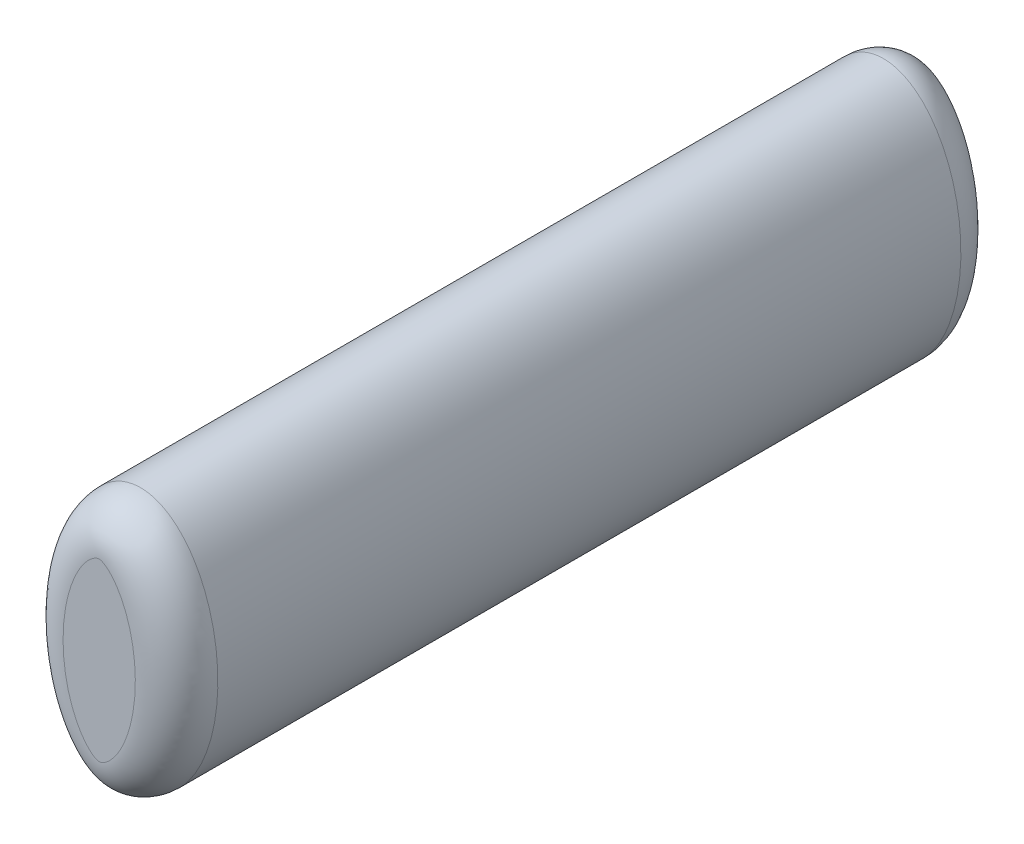
from build123d import *

# Parameters (mm, degrees)
AUFSATZ_LINEAR_AUSTRAGEN2_DEPTH = 80
SKIZZE4_W                       = 40
SKIZZE4_H                       = 5
SCHNITT_LINEAR_AUSTRAGEN1_DEPTH = 1.5
VERRUNDUNG2_R                   = 4


with BuildPart() as part:
    # Skizze1 → Aufsatz-Linear austragen2 (new body)
    with BuildSketch(Plane.XY):
        with BuildLine():
            Line((0, 12.5), (0, 0))
            Line((0, 0), (-7.5, 0))
            add(Edge.make_bspline(
                [(0, 12.5), (-7.5, 12.5), (-7.5, 0)],
                knots=[0, 0, 0, 1.570796327, 1.570796327, 1.570796327], degree=2, weights=[1, 0.707106781, 1]))
        make_face()
    extrude(amount=AUFSATZ_LINEAR_AUSTRAGEN2_DEPTH)

    # Skizze4 → Schnitt-Linear austragen1 (cut)
    with BuildSketch(Plane(origin=(0, 0, 0), x_dir=(0, 0, -1), z_dir=(1, 0, 0))):
        with Locations((-20, 2.5)):
            Rectangle(SKIZZE4_W, SKIZZE4_H)
    extrude(amount=-SCHNITT_LINEAR_AUSTRAGEN1_DEPTH, mode=Mode.SUBTRACT)

    # Verrundung2
    verrundung2_edges = [part.edges().sort_by_distance(p)[0] for p in [
        (-5.885487055, 7.747946344, 0),
        (-5.885487055, 7.747946344, 80),
    ]]
    fillet(verrundung2_edges, radius=VERRUNDUNG2_R)

    # Spiegeln1: part across plane


with BuildPart() as part_1:
    add(part.part)
    add(part.part.mirror(Plane(origin=(0, 0, 80), x_dir=(0, 0, 1), z_dir=(0, 1, 0))))

    # Spiegeln2: part across plane


with BuildPart() as part_2:
    add(part_1.part)
    add(part_1.part.mirror(Plane(origin=(0, 12.5, 80), x_dir=(0, 0, 1), z_dir=(-1, 0, 0))))


solid = part_2.part
